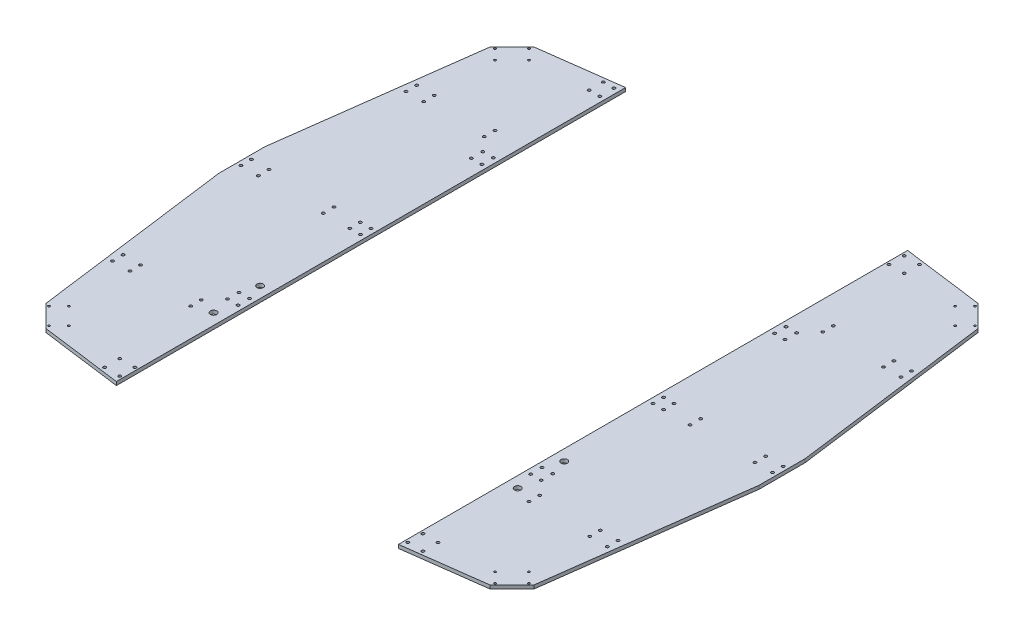
from build123d import *

# Parameters (mm, degrees)
SKETCH_1_R               = 1.5
SKETCH_1_R_2             = 2.000000001
SKETCH_1_R_3             = 2
SKETCH_1_R_4             = 4.5
SKETCH_1_R_5             = 2.000000003
SKETCH_1_R_6             = 1.999999999
SKETCH_1_R_7             = 250
EXTRUDE_2_DEPTH          = 5
CUT_EXTRUDE_1_DEPTH      = 542.772616539
CUT_EXTRUDE_1_DEPTH_BACK = 122
CUT_EXTRUDE_2_DEPTH      = 527.431195247
CUT_EXTRUDE_2_DEPTH_BACK = 39
SKETCH_3_R               = 2
CUT_EXTRUDE_3_DEPTH      = 20
CUT_EXTRUDE_3_DEPTH_BACK = 527.431195247
SKETCH_4_R               = 2
SKETCH_5_R               = 2
EXTRUDE_3_DEPTH          = 5


with BuildPart() as part:
    # 草图1 → 凸台-拉伸2 (new body)
    with BuildSketch(Plane(origin=(0, 0, 0), x_dir=(1, 0, 0), z_dir=(0, 1, 0))):
        Polygon((-32.720120418, 383.074776011), (-314.922171201, 345.922171201), (-345.922171201, 314.922171201), (-383.074776011, 32.720120418), (-383.074776011, -32.720120418), (-345.922171201, -314.922171201), (-314.922171201, -345.922171201), (-32.720120418, -383.074776011), (32.720120418, -383.074776011), (314.922171201, -345.922171201), (345.922171201, -314.922171201), (383.074776011, -32.720120418), (383.074776011, 32.720120418), (345.922171201, 314.922171201), (314.922171201, 345.922171201), (32.720120418, 383.074776011), (0, 383.074776011), align=None)
        with Locations((-316.280035574, -340.321666135)):
            Circle(SKETCH_1_R, mode=Mode.SUBTRACT)
        with Locations((-340.321666134, -316.280035574)):
            Circle(SKETCH_1_R, mode=Mode.SUBTRACT)
        with Locations((-302.137899951, -326.179530511)):
            Circle(SKETCH_1_R, mode=Mode.SUBTRACT)
        with Locations((-326.179530511, -302.137899951)):
            Circle(SKETCH_1_R, mode=Mode.SUBTRACT)
        with Locations((-350.918362047, -215.681953428)):
            Circle(SKETCH_1_R_2, mode=Mode.SUBTRACT)
        with Locations((-350.918362047, -200.681953428)):
            Circle(SKETCH_1_R_2, mode=Mode.SUBTRACT)
        with Locations((-325.918362047, -215.681953428)):
            Circle(SKETCH_1_R_2, mode=Mode.SUBTRACT)
        with Locations((-325.918362047, -200.681953428)):
            Circle(SKETCH_1_R_2, mode=Mode.SUBTRACT)
        with Locations((-240, -215.681953429)):
            Circle(SKETCH_1_R_3, mode=Mode.SUBTRACT)
        with Locations((-240, -200.681953429)):
            Circle(SKETCH_1_R_3, mode=Mode.SUBTRACT)
        with Locations((-215.612697258, -207.55428794)):
            Circle(SKETCH_1_R_4, mode=Mode.SUBTRACT)
        with Locations((-222.5, -181.030079822)):
            Circle(SKETCH_1_R_3, mode=Mode.SUBTRACT)
        with Locations((-207.5, -181.030079822)):
            Circle(SKETCH_1_R_3, mode=Mode.SUBTRACT)
        with Locations((-222.5, -164.825516547)):
            Circle(SKETCH_1_R_3, mode=Mode.SUBTRACT)
        with Locations((-207.5, -164.825516547)):
            Circle(SKETCH_1_R_3, mode=Mode.SUBTRACT)
        with Locations((-215.612697258, -141.55428794)):
            Circle(SKETCH_1_R_4, mode=Mode.SUBTRACT)
        with Locations((-377.074776011, -7.499878938)):
            Circle(SKETCH_1_R_3, mode=Mode.SUBTRACT)
        with Locations((-352.074776011, -7.499878938)):
            Circle(SKETCH_1_R_3, mode=Mode.SUBTRACT)
        with Locations((-260, -7.5)):
            Circle(SKETCH_1_R_3, mode=Mode.SUBTRACT)
        with Locations((316.280035574, -340.321666135)):
            Circle(SKETCH_1_R, mode=Mode.SUBTRACT)
        with Locations((302.13789995, -326.179530511)):
            Circle(SKETCH_1_R, mode=Mode.SUBTRACT)
        with Locations((326.179530511, -302.137899951)):
            Circle(SKETCH_1_R, mode=Mode.SUBTRACT)
        with Locations((340.321666135, -316.280035574)):
            Circle(SKETCH_1_R, mode=Mode.SUBTRACT)
        with Locations((215.612697258, -207.55428794)):
            Circle(SKETCH_1_R_4, mode=Mode.SUBTRACT)
        with Locations((240, -215.681953429)):
            Circle(SKETCH_1_R_3, mode=Mode.SUBTRACT)
        with Locations((240, -200.681953429)):
            Circle(SKETCH_1_R_3, mode=Mode.SUBTRACT)
        with Locations((325.918362046, -215.681953435)):
            Circle(SKETCH_1_R_5, mode=Mode.SUBTRACT)
        with Locations((325.918362046, -200.681953435)):
            Circle(SKETCH_1_R_5, mode=Mode.SUBTRACT)
        with Locations((350.918362046, -215.681953435)):
            Circle(SKETCH_1_R_5, mode=Mode.SUBTRACT)
        with Locations((350.918362046, -200.681953435)):
            Circle(SKETCH_1_R_5, mode=Mode.SUBTRACT)
        with Locations((207.5, -181.030079822)):
            Circle(SKETCH_1_R_3, mode=Mode.SUBTRACT)
        with Locations((222.5, -181.030079822)):
            Circle(SKETCH_1_R_3, mode=Mode.SUBTRACT)
        with Locations((207.5, -164.825516547)):
            Circle(SKETCH_1_R_3, mode=Mode.SUBTRACT)
        with Locations((222.5, -164.825516547)):
            Circle(SKETCH_1_R_3, mode=Mode.SUBTRACT)
        with Locations((215.612697258, -141.55428794)):
            Circle(SKETCH_1_R_4, mode=Mode.SUBTRACT)
        with Locations((260, -7.5)):
            Circle(SKETCH_1_R_3, mode=Mode.SUBTRACT)
        with Locations((352.074776011, -7.595099646)):
            Circle(SKETCH_1_R_3, mode=Mode.SUBTRACT)
        with Locations((377.074776011, -7.595099646)):
            Circle(SKETCH_1_R_3, mode=Mode.SUBTRACT)
        with Locations((-377.074776011, 7.500121062)):
            Circle(SKETCH_1_R_3, mode=Mode.SUBTRACT)
        with Locations((-352.074776011, 7.500121062)):
            Circle(SKETCH_1_R_3, mode=Mode.SUBTRACT)
        with Locations((-260, 7.5)):
            Circle(SKETCH_1_R_3, mode=Mode.SUBTRACT)
        with Locations((-222.5, 164.825516547)):
            Circle(SKETCH_1_R_3, mode=Mode.SUBTRACT)
        with Locations((-207.5, 164.825516547)):
            Circle(SKETCH_1_R_3, mode=Mode.SUBTRACT)
        with Locations((-222.5, 181.030079822)):
            Circle(SKETCH_1_R_3, mode=Mode.SUBTRACT)
        with Locations((-207.5, 181.030079822)):
            Circle(SKETCH_1_R_3, mode=Mode.SUBTRACT)
        with Locations((-350.918362047, 200.681953428)):
            Circle(SKETCH_1_R_6, mode=Mode.SUBTRACT)
        with Locations((-350.918362047, 215.681953428)):
            Circle(SKETCH_1_R_6, mode=Mode.SUBTRACT)
        with Locations((-325.918362047, 200.681953428)):
            Circle(SKETCH_1_R_6, mode=Mode.SUBTRACT)
        with Locations((-325.918362047, 215.681953428)):
            Circle(SKETCH_1_R_6, mode=Mode.SUBTRACT)
        with Locations((-240, 200.681953428)):
            Circle(SKETCH_1_R_3, mode=Mode.SUBTRACT)
        with Locations((-240, 215.681953428)):
            Circle(SKETCH_1_R_3, mode=Mode.SUBTRACT)
        with Locations((-340.321666134, 316.280035574)):
            Circle(SKETCH_1_R, mode=Mode.SUBTRACT)
        with Locations((-326.179530511, 302.137899951)):
            Circle(SKETCH_1_R, mode=Mode.SUBTRACT)
        with Locations((-302.13789995, 326.179530511)):
            Circle(SKETCH_1_R, mode=Mode.SUBTRACT)
        with Locations((-316.280035574, 340.321666134)):
            Circle(SKETCH_1_R, mode=Mode.SUBTRACT)
        Circle(SKETCH_1_R_7, mode=Mode.SUBTRACT)
        with Locations((260, 7.5)):
            Circle(SKETCH_1_R_3, mode=Mode.SUBTRACT)
        with Locations((352.074776011, 7.500121062)):
            Circle(SKETCH_1_R_3, mode=Mode.SUBTRACT)
        with Locations((377.074776011, 7.500121062)):
            Circle(SKETCH_1_R_3, mode=Mode.SUBTRACT)
        with Locations((207.5, 164.825516547)):
            Circle(SKETCH_1_R_3, mode=Mode.SUBTRACT)
        with Locations((222.5, 164.825516547)):
            Circle(SKETCH_1_R_3, mode=Mode.SUBTRACT)
        with Locations((207.5, 181.030079822)):
            Circle(SKETCH_1_R_3, mode=Mode.SUBTRACT)
        with Locations((222.5, 181.030079822)):
            Circle(SKETCH_1_R_3, mode=Mode.SUBTRACT)
        with Locations((240, 200.681953428)):
            Circle(SKETCH_1_R_3, mode=Mode.SUBTRACT)
        with Locations((240, 215.681953428)):
            Circle(SKETCH_1_R_3, mode=Mode.SUBTRACT)
        with Locations((325.918362046, 200.681953435)):
            Circle(SKETCH_1_R_6, mode=Mode.SUBTRACT)
        with Locations((325.918362046, 215.681953435)):
            Circle(SKETCH_1_R_6, mode=Mode.SUBTRACT)
        with Locations((350.918362046, 200.681953435)):
            Circle(SKETCH_1_R_6, mode=Mode.SUBTRACT)
        with Locations((350.918362046, 215.681953435)):
            Circle(SKETCH_1_R_6, mode=Mode.SUBTRACT)
        with Locations((326.179530511, 302.13789995)):
            Circle(SKETCH_1_R, mode=Mode.SUBTRACT)
        with Locations((302.137899951, 326.179530511)):
            Circle(SKETCH_1_R, mode=Mode.SUBTRACT)
        with Locations((340.321666135, 316.280035574)):
            Circle(SKETCH_1_R, mode=Mode.SUBTRACT)
        with Locations((316.280035574, 340.321666134)):
            Circle(SKETCH_1_R, mode=Mode.SUBTRACT)
    extrude(amount=EXTRUDE_2_DEPTH)

    # 草图2 → 切除-拉伸1 (cut, two sides: drawn at the far end of the back side and taken through both)
    with BuildSketch(Plane(origin=(0, 5, 0), x_dir=(1, 0, 0), z_dir=(0, 1, 0)).offset(-CUT_EXTRUDE_1_DEPTH_BACK)):
        Polygon((-200, 484.714921051), (-200, 361.051962068), (-200, -361.051962068), (-200, -418.819036359), (200, -418.819036359), (200, -361.051962068), (200, 361.051962068), (200, 484.714921051), align=None)
    extrude(amount=CUT_EXTRUDE_1_DEPTH + CUT_EXTRUDE_1_DEPTH_BACK, mode=Mode.SUBTRACT)


with BuildPart() as cut_extrude_1_piece_1:
    # of the separate pieces the step leaves, piece 1, a body of its own (cut_extrude_1_pieces)
    add(part.part.solids().sort_by_distance((-314.922171201, 0, 345.922171201))[0])

    # 草图3 → 切除-拉伸2 (cut, two sides: drawn at the far end of the back side and taken through both)
    with BuildSketch(Plane(origin=(0, 0, 0), x_dir=(-1, 0, 0), z_dir=(0, -1, 0)).offset(-CUT_EXTRUDE_2_DEPTH_BACK)):
        with Locations((225.752728605, -352.02249242)):
            Circle(SKETCH_3_R)
        with Locations((204.247271395, -352.02249242)):
            Circle(SKETCH_3_R)
        with Locations((225.752728605, -330.517035211)):
            Circle(SKETCH_3_R)
        with Locations((204.247271395, -330.517035211)):
            Circle(SKETCH_3_R)
    extrude(amount=CUT_EXTRUDE_2_DEPTH + CUT_EXTRUDE_2_DEPTH_BACK, mode=Mode.SUBTRACT)


with BuildPart() as cut_extrude_1_piece_2:
    # of the separate pieces the step leaves, piece 2, a body of its own (cut_extrude_1_pieces)
    add(part.part.solids().sort_by_distance((200, 0, 361.051962068))[0])


with BuildPart() as cut_extrude_3_tool:
    # 草图4 → 切除-拉伸3 (new, two sides: drawn at the far end of the back side and taken through both)
    with BuildSketch(Plane(origin=(0, 5, 0), x_dir=(1, 0, 0), z_dir=(0, 1, 0)).offset(-CUT_EXTRUDE_3_DEPTH_BACK)):
        with Locations((-207.5, 352.018568286)):
            Circle(SKETCH_4_R)
        with Locations((-222.5, 352.018568286)):
            Circle(SKETCH_4_R)
        with Locations((-222.5, 332.018568286)):
            Circle(SKETCH_4_R)
        with Locations((-207.5, 332.018568286)):
            Circle(SKETCH_4_R)
        with Locations((204.247271395, 330.513111077)):
            Circle(SKETCH_4_R)
        with Locations((225.752728605, 330.513111077)):
            Circle(SKETCH_4_R)
        with Locations((204.247271395, 352.018568286)):
            Circle(SKETCH_4_R)
        with Locations((225.752728605, 352.018568286)):
            Circle(SKETCH_4_R)
        with Locations((204.247271395, -352.02249242)):
            Circle(SKETCH_4_R)
        with Locations((225.752728605, -352.02249242)):
            Circle(SKETCH_4_R)
        with Locations((204.247271395, -330.517035211)):
            Circle(SKETCH_4_R)
        with Locations((225.752728605, -330.517035211)):
            Circle(SKETCH_4_R)
    extrude(amount=CUT_EXTRUDE_3_DEPTH + CUT_EXTRUDE_3_DEPTH_BACK)


with BuildPart() as cut_extrude_1_piece_1_1:
    add(cut_extrude_1_piece_1.part)

    # 切除-拉伸3: cut by cut_extrude_3_tool
    add(cut_extrude_3_tool.part, mode=Mode.SUBTRACT)



with BuildPart() as cut_extrude_1_piece_2_1:
    add(cut_extrude_1_piece_2.part)

    # 切除-拉伸3: cut by cut_extrude_3_tool
    add(cut_extrude_3_tool.part, mode=Mode.SUBTRACT)


with BuildPart() as cut_extrude_1_piece_1_2:
    add(cut_extrude_1_piece_1_1.part)

    add(cut_extrude_1_piece_2_1.part)  # 凸台-拉伸3 merges 切除-拉伸1 piece 2
    # 草图5 → 凸台-拉伸3 (add)
    # profile 1 of 2: a face of its own
    with BuildSketch(Plane(origin=(0, 5, 0), x_dir=(1, 0, 0), z_dir=(0, 1, 0))):
        with BuildLine():
            Line((-200, -150), (-200, 150))
            ThreePointArc((-200, 150), (-250, 0), (-200, -150))
        make_face()
        with Locations((-222.5, -7.5)):
            Circle(SKETCH_5_R, mode=Mode.SUBTRACT)
        with Locations((-207.5, -7.5)):
            Circle(SKETCH_5_R, mode=Mode.SUBTRACT)
        with Locations((-222.5, 7.5)):
            Circle(SKETCH_5_R, mode=Mode.SUBTRACT)
        with Locations((-207.5, 7.5)):
            Circle(SKETCH_5_R, mode=Mode.SUBTRACT)
    # profile 2 of 2: a face of its own
    with BuildSketch(Plane(origin=(0, 5, 0), x_dir=(1, 0, 0), z_dir=(0, 1, 0))):
        with BuildLine():
            ThreePointArc((200, -150), (250, 0), (200, 150))
            Line((200, 150), (200, -150))
        make_face()
        with Locations((207.5, -7.5)):
            Circle(SKETCH_5_R, mode=Mode.SUBTRACT)
        with Locations((222.5, -7.5)):
            Circle(SKETCH_5_R, mode=Mode.SUBTRACT)
        with Locations((207.5, 7.5)):
            Circle(SKETCH_5_R, mode=Mode.SUBTRACT)
        with Locations((222.5, 7.5)):
            Circle(SKETCH_5_R, mode=Mode.SUBTRACT)
    extrude(amount=-EXTRUDE_3_DEPTH)


solid = cut_extrude_1_piece_1_2.part
